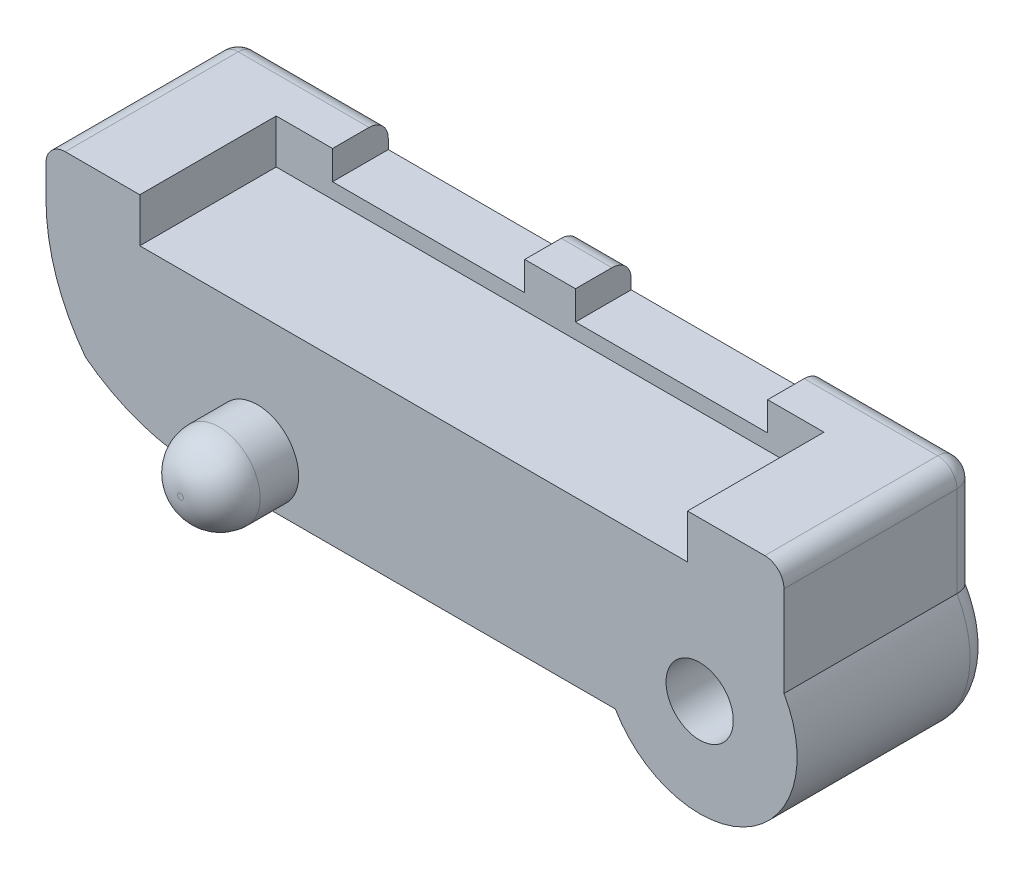
from build123d import *

# Parameters (mm, degrees)
CROQUIS1_W              = 33
CROQUIS1_H              = 5
SALIENTE_EXTRUIR1_DEPTH = 8.5
CROQUIS2_W              = 5
CROQUIS2_H              = 8.5
SALIENTE_EXTRUIR2_DEPTH = 14
CORTAR_EXTRUIR1_REACH   = 34.055
CROQUIS5_R              = 5.070689822
SALIENTE_EXTRUIR3_DEPTH = 5
CROQUIS6_R              = 1.75
CORTAR_EXTRUIR2_DEPTH   = 5
SALIENTE_EXTRUIR4_START = 5
CROQUIS7_R              = 3.5
SALIENTE_EXTRUIR4_DEPTH = 5
SALIENTE_EXTRUIR5_DEPTH = 2.3
CROQUIS9_W              = 10
CROQUIS9_H              = 2.9
CORTAR_EXTRUIR3_DEPTH   = 1.5
CHAFL_N1_SIZE           = 4
REDONDEO1_R             = 10
REDONDEO3_R             = 1
REDONDEO4_R             = 1
REDONDEO5_R             = 1
REDONDEO6_R             = 1
REDONDEO7_R             = 1
CROQUIS10_R             = 2.15
SALIENTE_EXTRUIR6_DEPTH = 4
REDONDEO8_R             = 2


with BuildPart() as part:
    # Croquis1 → Saliente-Extruir1 (new body)
    with BuildSketch(Plane(origin=(0, 0, 0), x_dir=(1, 0, 0), z_dir=(0, 1, 0))):
        Rectangle(CROQUIS1_W, CROQUIS1_H)
    extrude(amount=SALIENTE_EXTRUIR1_DEPTH)

    # Croquis2 → Saliente-Extruir2 (add)
    with BuildSketch(Plane(origin=(16.5, 0, 0), x_dir=(0, 0, -1), z_dir=(1, 0, 0))):
        with Locations((0, 4.25)):
            Rectangle(CROQUIS2_W, CROQUIS2_H)
    extrude(amount=SALIENTE_EXTRUIR2_DEPTH)

    # Croquis4 → Cortar-Extruir1 (cut, up to next)
    with BuildSketch(Plane(origin=(0, 0, -2.5), x_dir=(-1, 0, 0), z_dir=(0, 0, -1)), mode=Mode.PRIVATE) as cortar_extruir1_sk1:
        Polygon((-21.898835729, 8.5), (-21.898835729, 2.753380039), (-21.898835729, 0), (-30.5, 0), (-30.5, 8.5), align=None)
    cortar_extruir1_tool1 = extrude(cortar_extruir1_sk1.sketch, amount=-CORTAR_EXTRUIR1_REACH, mode=Mode.PRIVATE) & part.part
    add(cortar_extruir1_tool1.solids().sort_by_distance((26.199418, 4.25, -2.5))[0], mode=Mode.SUBTRACT)

    # Croquis5 → Saliente-Extruir3 (add)
    with BuildSketch(Plane(origin=(0, 0, -2.5), x_dir=(-1, 0, 0), z_dir=(0, 0, -1))):
        with Locations((-17.511321809, 2.541971061)):
            Circle(CROQUIS5_R)
    extrude(amount=-SALIENTE_EXTRUIR3_DEPTH)

    # Croquis6 → Cortar-Extruir2 (cut)
    with BuildSketch(Plane(origin=(0, 0, -2.5), x_dir=(-1, 0, 0), z_dir=(0, 0, -1))):
        with Locations((-17.511321809, 2.541971061)):
            Circle(CROQUIS6_R)
    extrude(amount=-CORTAR_EXTRUIR2_DEPTH, mode=Mode.SUBTRACT)

    # Croquis7 → Saliente-Extruir4 (add)
    with BuildSketch(Plane(origin=(0, 0, -2.5), x_dir=(-1, 0, 0), z_dir=(0, 0, -1)).offset(SALIENTE_EXTRUIR4_START)):
        with BuildLine():
            Line((-21.898835729, 8.5), (-21.898835729, 5.083942123))
            ThreePointArc((-21.898835729, 5.083942123), (-20.05329287, -1.845542858), (-13.123807889, 0))
            Line((-13.123807889, 0), (16.5, 0))
            Line((16.5, 0), (16.5, 8.5))
            Line((16.5, 8.5), (-21.898835729, 8.5))
        make_face()
        with Locations((-17.511321809, 2.541971061)):
            Circle(CROQUIS7_R, mode=Mode.SUBTRACT)
    extrude(amount=-SALIENTE_EXTRUIR4_DEPTH)

    # Croquis8 → Saliente-Extruir5 (add)
    with BuildSketch(Plane(origin=(0, 8.5, 0), x_dir=(1, 0, 0), z_dir=(0, 1, 0))):
        Polygon((-16.5, -2.5), (-11.620504371, -2.5), (-11.620504371, -2.1), (-11.620504371, 4.6), (16.879495629, 4.6), (16.879495629, -2.1), (16.879495629, -2.5), (21.898835729, -2.5), (21.898835729, 7.5), (-16.5, 7.5), align=None)
    extrude(amount=SALIENTE_EXTRUIR5_DEPTH)

    # Croquis9 → Cortar-Extruir3 (cut)
    with BuildSketch(Plane(origin=(0, 10.8, 0), x_dir=(1, 0, 0), z_dir=(0, 1, 0))):
        with Locations((8.949495629, 6.05)):
            Rectangle(CROQUIS9_W, CROQUIS9_H)
        with Locations((-3.690504371, 6.05)):
            Rectangle(CROQUIS9_W, CROQUIS9_H)
    extrude(amount=-CORTAR_EXTRUIR3_DEPTH, mode=Mode.SUBTRACT)

    # Chaflán1
    chafl_n1_edges = [part.edges().sort_by_distance(p)[0] for p in [
        (-16.5, 0, -2.5),
    ]]
    chamfer(chafl_n1_edges, length=CHAFL_N1_SIZE)

    # Redondeo1
    # the kernel refuses this fillet: 10 mm, written as the material it takes off along each edge
    with BuildSketch(Plane(origin=(-12.5, 0, 12.855339059), x_dir=(-0.7071067811865476, 0.7071067811865477, 0), z_dir=(0, 0, -1)), Plane(origin=(-16.5, 4, 12.855339059), x_dir=(0, 1, 0), z_dir=(0, 0, -1))) as redondeo1_piece_1:
        with BuildLine():
            CenterArc((REDONDEO1_R * 0.414213562373, REDONDEO1_R), REDONDEO1_R, 225, 45)
            Line((-REDONDEO1_R * 0.292893218813, REDONDEO1_R * 0.292893218813), (0, 0))
            Line((0, 0), (REDONDEO1_R * 0.414213562373, 0))
        make_face()
    extrude(amount=30.710678119, mode=Mode.SUBTRACT)

    # Redondeo3
    redondeo3_edges = [part.edges().sort_by_distance(p)[0] for p in [
        (-16.5, 9.471067812, -7.5),
        (-15.970669758, 4.931775157, -7.5),
        (-11.568224843, 0.529330242, -7.5),
        (2.382971757, 0, -7.5),
    ]]
    fillet(redondeo3_edges, radius=REDONDEO3_R)

    # Redondeo4
    redondeo4_edges = [part.edges().sort_by_distance(p)[0] for p in [
        (19.565273177, -2.094102606, -7.5),
        (21.898835729, 7.941971061, -7.5),
    ]]
    fillet(redondeo4_edges, radius=REDONDEO4_R)

    # Redondeo5
    redondeo5_edges = [part.edges().sort_by_distance(p)[0] for p in [
        (17.424165679, 10.8, -7.5),
        (21.60594251, 10.8, -7.207106781),
        (21.898835729, 10.8, -2),
    ]]
    fillet(redondeo5_edges, radius=REDONDEO5_R)

    # Redondeo6
    redondeo6_edges = [part.edges().sort_by_distance(p)[0] for p in [
        (-12.095252185, 10.8, -7.5),
        (-16.5, 10.8, -2),
        (-16.207106781, 10.8, -7.207106781),
    ]]
    fillet(redondeo6_edges, radius=REDONDEO6_R)

    # Redondeo7
    redondeo7_edges = [part.edges().sort_by_distance(p)[0] for p in [
        (2.629495629, 10.8, -7.5),
    ]]
    fillet(redondeo7_edges, radius=REDONDEO7_R)

    # Croquis10 → Saliente-Extruir6 (add)
    with BuildSketch(Plane.XY.offset(2.5)):
        with Locations((-5.503268941, 2.252495098)):
            Circle(CROQUIS10_R)
    extrude(amount=SALIENTE_EXTRUIR6_DEPTH)

    # Redondeo8
    redondeo8_edges = [part.edges().sort_by_distance(p)[0] for p in [
        (-7.653268941, 2.252495098, 6.5),
    ]]
    fillet(redondeo8_edges, radius=REDONDEO8_R)


solid = part.part
